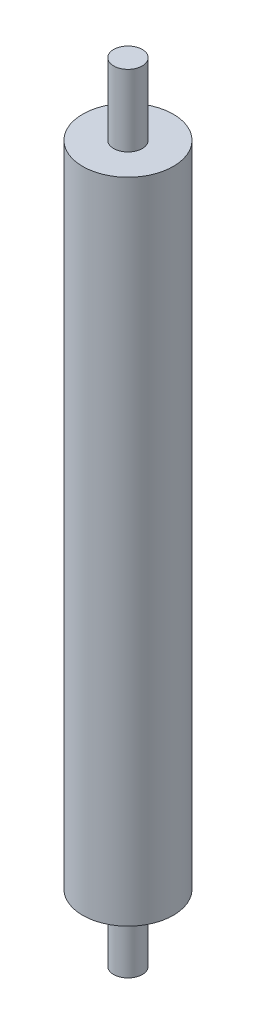
from build123d import *

# Parameters (mm, degrees)
SKETCH_1_R           = 1.9
EXTRUDE_2_DEPTH      = 27.2
EXTRUDE_3_DEPTH      = 3
EXTRUDE_3_DEPTH_BACK = 30
SKETCH_2_R           = 0.6


with BuildPart() as part:
    # 草图1 → 凸台-拉伸2 (new body)
    with BuildSketch(Plane(origin=(0, 0, 0), x_dir=(1, 0, 0), z_dir=(0, 1, 0))):
        Circle(SKETCH_1_R)
    extrude(amount=EXTRUDE_2_DEPTH)

    # 草图2 → 凸台-拉伸3 (add, two sides: drawn at the far end of the back side and taken through both)
    with BuildSketch(Plane(origin=(0, 27.2, 0), x_dir=(1, 0, 0), z_dir=(0, 1, 0)).offset(-EXTRUDE_3_DEPTH_BACK)):
        Circle(SKETCH_2_R)
    extrude(amount=EXTRUDE_3_DEPTH + EXTRUDE_3_DEPTH_BACK)


solid = part.part
